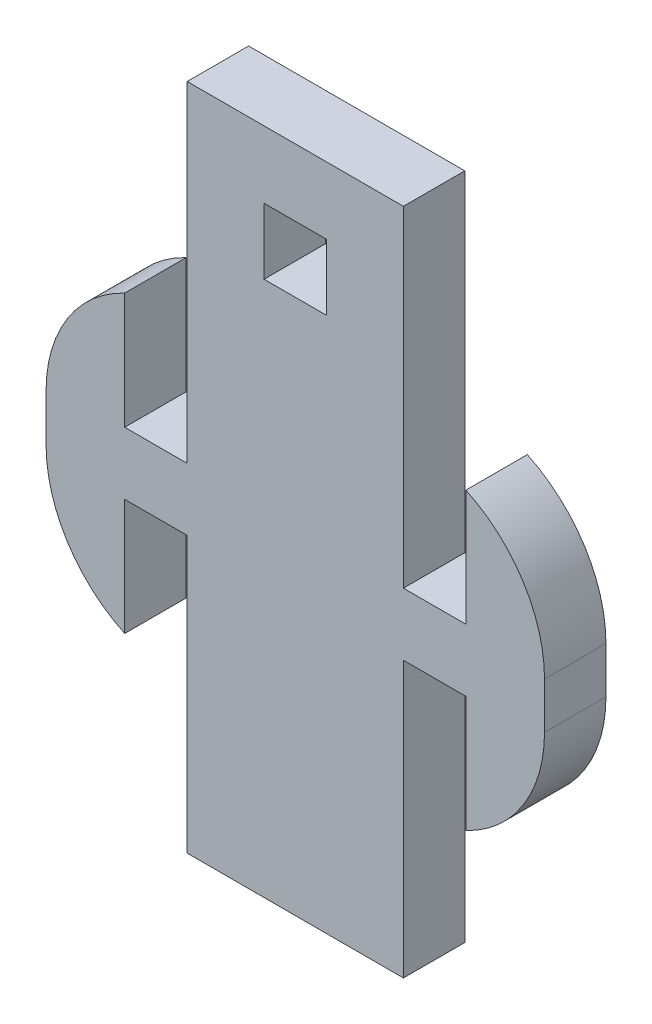
from build123d import *

# Parameters (mm, degrees)
BOSS_EXTRUDE1_DEPTH = 3.125
FILLET1_R           = 7


with BuildPart() as part:
    # Sketch2 → Boss-Extrude1 (new body)
    with BuildSketch(Plane.XY):
        Polygon((0, 17), (5.5, 17), (5.5, 0.175), (8.68, 0.175), (8.68, 6.0875), (12.68, 6.0875), (12.68, -8.9125), (8.68, -8.9125), (8.68, -3), (5.5, -3), (5.5, -17), (0, -17), (0, 10.241210398), (1.59, 10.241210398), (1.59, 13.59), (0, 13.59), align=None)
    boss_extrude1 = extrude(amount=BOSS_EXTRUDE1_DEPTH)

    # Mirror1: Boss-Extrude1 across plane
    add(boss_extrude1.mirror(Plane(origin=(0, 10.241210398, 3.125), x_dir=(0, 0, 1), z_dir=(1, 0, 0))))

    # Fillet1
    # the kernel refuses this fillet: 7 mm, written as the material it takes off along each edge
    with BuildSketch(Plane(origin=(-12.68, -8.9125, -15.811388301), x_dir=(0, 1, 0), z_dir=(0, 0, 1)), Plane(origin=(12.68, 6.0875, -15.811388301), x_dir=(0, -1, 0), z_dir=(0, 0, 1))) as fillet1_piece_1:
        with BuildLine():
            CenterArc((6.32455532, -7), FILLET1_R, 90, 64.623066475)
            Line((0, -4), (-0.126491106, -3.94))
            ThreePointArc((-0.126491106, -3.94), (-0.14, -2), (-0.14, 0))
            Line((-0.14, 0), (0, 0.14))
            Line((0, 0.14), (6.32455532, 0.14))
            Line((6.32455532, 0.14), (6.32455532, 0))
        make_face()
    extrude(amount=34.747776602, mode=Mode.SUBTRACT)
    with BuildSketch(Plane(origin=(-12.68, 6.0875, -15.811388301), x_dir=(1, 0, 0), z_dir=(0, 0, 1)), Plane(origin=(12.68, -8.9125, -15.811388301), x_dir=(-1, 0, 0), z_dir=(0, 0, 1))) as fillet1_piece_2:
        with BuildLine():
            CenterArc((7, -6.32455532), FILLET1_R, 115.376933525, 64.623066475)
            Line((0, -6.32455532), (-0.14, -6.32455532))
            Line((-0.14, -6.32455532), (-0.14, 0))
            Line((-0.14, 0), (0, 0.14))
            ThreePointArc((0, 0.14), (2, 0.14), (3.94, 0.126491106))
            Line((3.94, 0.126491106), (4, 0))
        make_face()
    extrude(amount=34.747776602, mode=Mode.SUBTRACT)


solid = part.part
